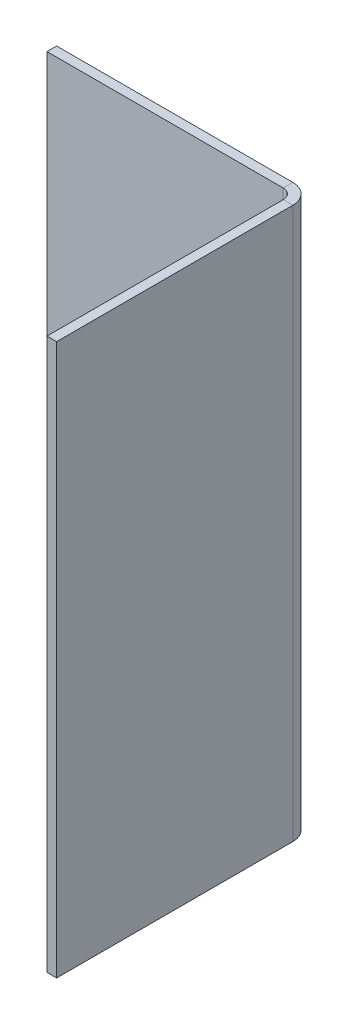
from build123d import *

# Parameters (mm, degrees)
SKETCH1_W              = 36
SKETCH1_H              = 40
BASE_FLANGE1_DEPTH     = 0.7
SKETCHED_BEND1_DEPTH   = 40
SKETCHED_BEND1_2_DEPTH = 40


# Read off the part's stored shape, not the designer's step: Sketched Bend1
# Sheet-metal steps are written as plain solids
with BuildPart() as part:
    # Sketch1 → Base-Flange1 (new body)
    with BuildSketch(Plane.XY):
        with Locations((18, 20)):
            Rectangle(SKETCH1_W, SKETCH1_H)
    extrude(amount=-BASE_FLANGE1_DEPTH)

    # Sketched Bend1 outline → Sketched Bend1 (cut)
    with BuildSketch(Plane(origin=(0, 0, 0), x_dir=(1, 0, 0), z_dir=(0, 1, 0))):
        with BuildLine():
            ThreePointArc((17.146586356, 0.7), (17.855677324, 0.512803682), (18.379971941, 0))
            Line((18.379971941, 0), (36, 0))
            Line((36, 0), (36, 0.7))
            Line((36, 0.7), (17.146586356, 0.7))
        make_face()
    extrude(amount=SKETCHED_BEND1_DEPTH, mode=Mode.SUBTRACT)

    # Sketched Bend1 2 outline → Sketched Bend1 2 (add)
    with BuildSketch(Plane(origin=(0, 0, 0), x_dir=(1, 0, 0), z_dir=(0, 1, 0))):
        with BuildLine():
            Line((17.883186356, -0.7366), (17.883186356, -17.883186356))
            Line((17.883186356, -17.883186356), (18.583186356, -17.883186356))
            Line((18.583186356, -17.883186356), (18.583186356, -0.7366))
            ThreePointArc((18.583186356, -0.7366), (18.531451203, -0.354541216), (18.379971941, 0))
            Line((18.379971941, 0), (17.146586356, 0))
            ThreePointArc((17.146586356, 0), (17.667441211, -0.215745145), (17.883186356, -0.7366))
        make_face()
    extrude(amount=SKETCHED_BEND1_2_DEPTH)


solid = part.part
